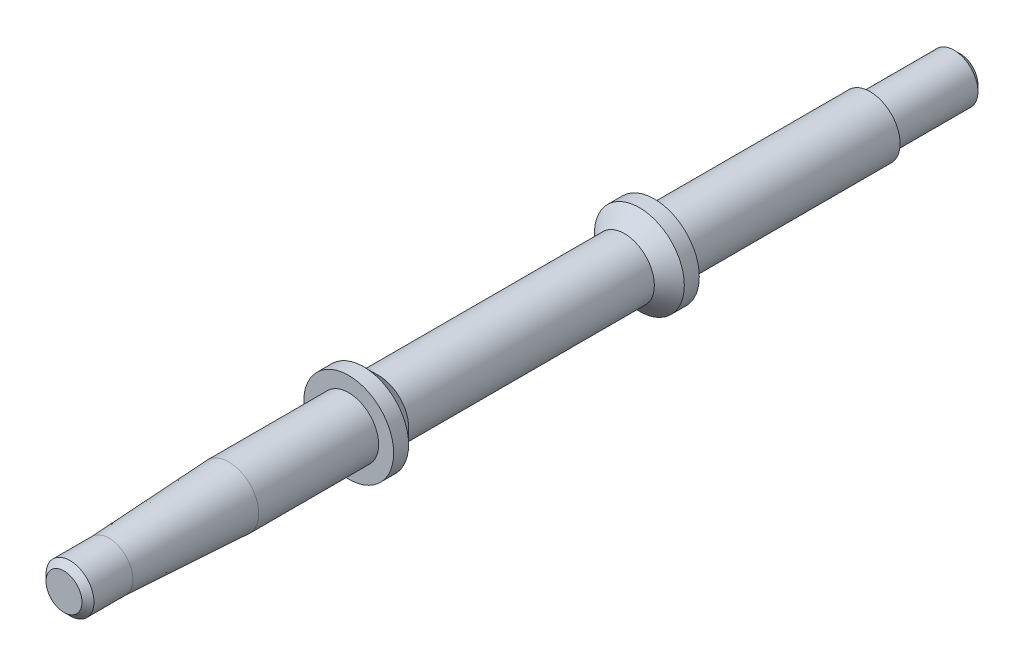
from build123d import *

# Parameters (mm, degrees)
SKETCH_1_R          = 7.5
EXTRUDE_1_DEPTH     = 51
SKETCH_2_R          = 5
EXTRUDE_2_DEPTH     = 20
EXTRUDE_START       = 36
SKETCH_3_R          = 5
EXTRUDE_3_DEPTH     = 36
SKETCH_4_OUTSIDE_W  = 38.816
SKETCH_4_OUTSIDE_H  = 38.816
SKETCH_4_OUTSIDE_R  = 5
CUT_EXTRUDE_1_DEPTH = 46
SKETCH_5_R          = 4
EXTRUDE_4_DEPTH     = 15
SKETCH_6_R          = 5
EXTRUDE_5_DEPTH     = 20
EXTRUDE_5_TAPER     = 2.8625
EXTRUDE_START_2     = 7.5
SKETCH_7_R          = 4
EXTRUDE_6_DEPTH     = 7.5
CHAMFER_1_SIZE      = 2.5
CHAMFER_2_SIZE      = 1


with BuildPart() as part:
    # Эскиз1 → Бобышка-Вытянуть1 (new body)
    with BuildSketch(Plane.XY):
        Circle(SKETCH_1_R)
    extrude(amount=-EXTRUDE_1_DEPTH)

    # Эскиз2 → Бобышка-Вытянуть2 (add)
    with BuildSketch(Plane.XY):
        Circle(SKETCH_2_R)
    extrude(amount=EXTRUDE_2_DEPTH)

    # Эскиз3 → Бобышка-Вытянуть3 (add)
    with BuildSketch(Plane(origin=(0, 0, -51), x_dir=(-1, 0, 0), z_dir=(0, 0, -1)).offset(EXTRUDE_START)):
        with Locations(Location((0, 0, 0), (0, 0, 180))):
            Circle(SKETCH_3_R)
    extrude(amount=-EXTRUDE_3_DEPTH)

    # Эскиз4 outside → Вырез-Вытянуть1 (cut)
    with BuildSketch(Plane.XY.offset(-2.5)):
        Rectangle(SKETCH_4_OUTSIDE_W, SKETCH_4_OUTSIDE_H)
        Circle(SKETCH_4_OUTSIDE_R, mode=Mode.SUBTRACT)
    extrude(amount=-CUT_EXTRUDE_1_DEPTH, mode=Mode.SUBTRACT)

    # Эскиз5 → Бобышка-Вытянуть4 (add)
    with BuildSketch(Plane(origin=(0, 0, -87), x_dir=(-1, 0, 0), z_dir=(0, 0, -1))):
        Circle(SKETCH_5_R)
    extrude(amount=EXTRUDE_4_DEPTH)

    # Эскиз6 → Бобышка-Вытянуть5 (add)
    with BuildSketch(Plane.XY.offset(20)):
        Circle(SKETCH_6_R)
    extrude(amount=EXTRUDE_5_DEPTH, taper=EXTRUDE_5_TAPER)

    # Эскиз7 → Бобышка-Вытянуть6 (add)
    with BuildSketch(Plane.XY.offset(40).offset(EXTRUDE_START_2)):
        with Locations(Location((0, 0, 0), (0, 0, 180))):
            Circle(SKETCH_7_R)
    extrude(amount=-EXTRUDE_6_DEPTH)

    # Фаска1
    chamfer_1_edges = [part.edges().sort_by_distance(p)[0] for p in [
        (-5, 0, -48.5),
        (-5, 0, -2.5),
    ]]
    chamfer(chamfer_1_edges, length=CHAMFER_1_SIZE - 0.0001)  # a hair under: the kernel refuses the full size

    # Фаска2
    chamfer_2_edges = [part.edges().sort_by_distance(p)[0] for p in [
        (4, 0, -102),
        (4, 0, 47.5),
    ]]
    chamfer(chamfer_2_edges, length=CHAMFER_2_SIZE)


solid = part.part
